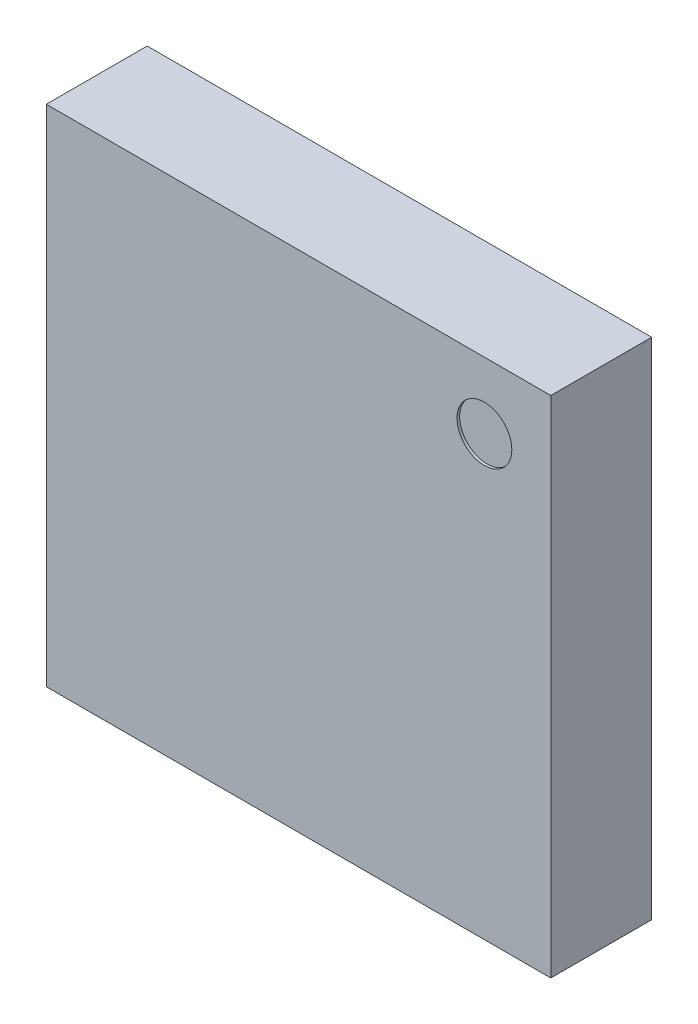
from build123d import *

# Parameters (mm, degrees)
SKETCH1_W           = 1.9
SKETCH1_H           = 1.9
BOSS_EXTRUDE1_DEPTH = 0.38
SKETCH2_R           = 0.125
BOSS_EXTRUDE2_DEPTH = 0.125
FILLET1_R           = 0.125
SKETCH3_R           = 0.103231073
CUT_EXTRUDE1_DEPTH  = 0.01


with BuildPart() as part:
    # Sketch1 → Boss-Extrude1 (new body)
    with BuildSketch(Plane.XY):
        Rectangle(SKETCH1_W, SKETCH1_H)
    extrude(amount=BOSS_EXTRUDE1_DEPTH)

    # Sketch2 → Boss-Extrude2 (add)
    with BuildSketch(Plane(origin=(0, 0, 0), x_dir=(-1, 0, 0), z_dir=(0, 0, -1))):
        with Locations(Location((0.75, 0.75, 0), (0, 0, 180))):
            Circle(SKETCH2_R)
        with Locations(Location((0.25, 0.75, 0), (0, 0, 180))):
            Circle(SKETCH2_R)
        with Locations(Location((-0.25, 0.75, 0), (0, 0, 180))):
            Circle(SKETCH2_R)
        with Locations(Location((-0.75, 0.75, 0), (0, 0, 180))):
            Circle(SKETCH2_R)
        with Locations(Location((-0.75, 0.25, 0), (0, 0, 180))):
            Circle(SKETCH2_R)
        with Locations(Location((0.25, -0.25, 0), (0, 0, 180))):
            Circle(SKETCH2_R)
        with Locations(Location((-0.25, -0.25, 0), (0, 0, 180))):
            Circle(SKETCH2_R)
        with Locations(Location((-0.75, -0.25, 0), (0, 0, 180))):
            Circle(SKETCH2_R)
        with Locations(Location((0.25, -0.75, 0), (0, 0, 180))):
            Circle(SKETCH2_R)
        with Locations(Location((-0.25, -0.75, 0), (0, 0, 180))):
            Circle(SKETCH2_R)
        with Locations(Location((-0.75, -0.75, 0), (0, 0, 180))):
            Circle(SKETCH2_R)
        with Locations(Location((0.75, 0.25, 0), (0, 0, 180))):
            Circle(SKETCH2_R)
        with Locations(Location((0.75, -0.25, 0), (0, 0, 180))):
            Circle(SKETCH2_R)
        with Locations(Location((0.75, -0.75, 0), (0, 0, 180))):
            Circle(SKETCH2_R)
    extrude(amount=BOSS_EXTRUDE2_DEPTH)

    # Fillet1
    fillet1_edges = [part.edges().sort_by_distance(p)[0] for p in [
        (-0.875, 0.75, -0.125),
        (-0.375, 0.75, -0.125),
        (0.125, 0.75, -0.125),
        (0.625, 0.75, -0.125),
        (0.625, 0.25, -0.125),
        (-0.375, -0.25, -0.125),
        (0.125, -0.25, -0.125),
        (0.625, -0.25, -0.125),
        (-0.375, -0.75, -0.125),
        (0.125, -0.75, -0.125),
        (0.625, -0.75, -0.125),
        (-0.875, 0.25, -0.125),
        (-0.875, -0.25, -0.125),
        (-0.875, -0.75, -0.125),
    ]]
    fillet(fillet1_edges, radius=FILLET1_R - 0.0001)  # a hair under: the kernel refuses the full size

    # Sketch3 → Cut-Extrude1 (cut)
    with BuildSketch(Plane.XY.offset(0.38)):
        with Locations((0.7, 0.7)):
            Circle(SKETCH3_R)
    extrude(amount=-CUT_EXTRUDE1_DEPTH, mode=Mode.SUBTRACT)


solid = part.part
